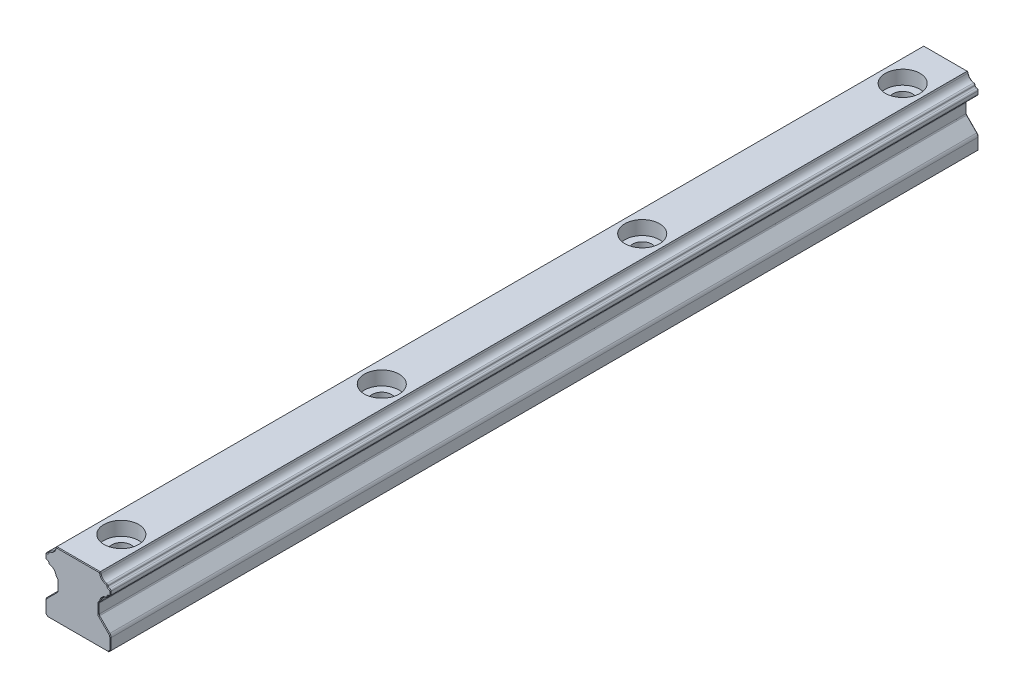
from build123d import *

# Parameters (mm, degrees)
BODY_DEPTH                                          = 200
AESTHETIC_CHAMFER_SIZE                              = 0.15
CBORE_FOR_M4_HEX_SOCKET_HEAD_CAP_SCREW1_D           = 4.5
CBORE_FOR_M4_HEX_SOCKET_HEAD_CAP_SCREW1_CBORE_D     = 8
CBORE_FOR_M4_HEX_SOCKET_HEAD_CAP_SCREW1_CBORE_DEPTH = 3.2
LPATTERN1_COUNT                                     = 4
LPATTERN1_PITCH                                     = 60


with BuildPart() as part:
    # Rail Profile → Body (new body)
    with BuildSketch(Plane.XY):
        with BuildLine():
            Line((-7, 0), (7, 0))
            Line((7, 0), (7.5, 0.5))
            Line((7.5, 0.5), (7.5, 3.085786438))
            ThreePointArc((7.5, 3.085786438), (7.423879533, 3.46846987), (7.207106781, 3.792893219))
            Line((7.207106781, 3.792893219), (4.867157288, 6.132842712))
            ThreePointArc((4.867157288, 6.132842712), (4.780448187, 6.262612052), (4.75, 6.415685425))
            Line((4.75, 6.415685425), (4.75, 8.584314575))
            ThreePointArc((4.75, 8.584314575), (4.780448187, 8.737387948), (4.867157288, 8.867157288))
            Line((4.867157288, 8.867157288), (5.062965362, 9.062965362))
            ThreePointArc((5.062965362, 9.062965362), (5.134996734, 9.161242682), (5.17409812, 9.27664646))
            ThreePointArc((5.17409812, 9.27664646), (5.61862915, 10.13137085), (6.47335354, 10.57590188))
            ThreePointArc((6.47335354, 10.57590188), (6.694124352, 10.694306692), (6.801170165, 10.920803148))
            ThreePointArc((6.801170165, 10.920803148), (6.915305692, 11.154571658), (7.149074202, 11.268707185))
            ThreePointArc((7.149074202, 11.268707185), (7.399691242, 11.400760606), (7.5, 11.665685425))
            Line((7.5, 11.665685425), (7.5, 12.334314575))
            ThreePointArc((7.5, 12.334314575), (7.399691242, 12.599239394), (7.149074202, 12.731292815))
            ThreePointArc((7.149074202, 12.731292815), (6.915305692, 12.845428342), (6.801170165, 13.079196852))
            ThreePointArc((6.801170165, 13.079196852), (6.694124352, 13.305693308), (6.47335354, 13.42409812))
            ThreePointArc((6.47335354, 13.42409812), (5.61862915, 13.86862915), (5.17409812, 14.72335354))
            ThreePointArc((5.17409812, 14.72335354), (5.134996734, 14.838757318), (5.062965362, 14.937034638))
            Line((5.062965362, 14.937034638), (5, 15))
            Line((5, 15), (-5, 15))
            Line((-5, 15), (-5.062965362, 14.937034638))
            ThreePointArc((-5.062965362, 14.937034638), (-5.134996734, 14.838757318), (-5.17409812, 14.72335354))
            ThreePointArc((-5.17409812, 14.72335354), (-5.61862915, 13.86862915), (-6.47335354, 13.42409812))
            ThreePointArc((-6.47335354, 13.42409812), (-6.694124352, 13.305693308), (-6.801170165, 13.079196852))
            ThreePointArc((-6.801170165, 13.079196852), (-6.915305692, 12.845428342), (-7.149074202, 12.731292815))
            ThreePointArc((-7.149074202, 12.731292815), (-7.399691242, 12.599239394), (-7.5, 12.334314575))
            Line((-7.5, 12.334314575), (-7.5, 11.665685425))
            ThreePointArc((-7.5, 11.665685425), (-7.399691242, 11.400760606), (-7.149074202, 11.268707185))
            ThreePointArc((-7.149074202, 11.268707185), (-6.915305692, 11.154571658), (-6.801170165, 10.920803148))
            ThreePointArc((-6.801170165, 10.920803148), (-6.694124352, 10.694306692), (-6.47335354, 10.57590188))
            ThreePointArc((-6.47335354, 10.57590188), (-5.61862915, 10.13137085), (-5.17409812, 9.27664646))
            ThreePointArc((-5.17409812, 9.27664646), (-5.134996734, 9.161242682), (-5.062965362, 9.062965362))
            Line((-5.062965362, 9.062965362), (-4.867157288, 8.867157288))
            ThreePointArc((-4.867157288, 8.867157288), (-4.780448187, 8.737387948), (-4.75, 8.584314575))
            Line((-4.75, 8.584314575), (-4.75, 6.415685425))
            ThreePointArc((-4.75, 6.415685425), (-4.780448187, 6.262612052), (-4.867157288, 6.132842712))
            Line((-4.867157288, 6.132842712), (-7.207106781, 3.792893219))
            ThreePointArc((-7.207106781, 3.792893219), (-7.423879533, 3.46846987), (-7.5, 3.085786438))
            Line((-7.5, 3.085786438), (-7.5, 0.5))
            Line((-7.5, 0.5), (-7, 0))
        make_face()
    extrude(amount=-BODY_DEPTH)

    # Aesthetic Chamfer
    aesthetic_chamfer_edges = [part.edges().sort_by_distance(p)[0] for p in [
        (-5.031482681, 14.968517319, 0),
        (-5.134996734, 14.838757318, 0),
        (-5.61862915, 13.86862915, 0),
        (-6.694124352, 13.305693308, 0),
        (-6.915305692, 12.845428342, 0),
        (-7.399691242, 12.599239394, 0),
        (-7.5, 12, 0),
        (-7.399691242, 11.400760606, 0),
        (-6.915305692, 11.154571658, 0),
        (-6.694124352, 10.694306692, 0),
        (-5.61862915, 10.13137085, 0),
        (-5.134996734, 9.161242682, 0),
        (-4.965061325, 8.965061325, 0),
        (-4.780448187, 8.737387948, 0),
        (-4.75, 7.5, 0),
        (-4.780448187, 6.262612052, 0),
        (-6.037132034, 4.962867966, 0),
        (-7.423879533, 3.46846987, 0),
        (-7.5, 1.792893219, 0),
        (-7.25, 0.25, 0),
        (0, 0, 0),
        (7.25, 0.25, 0),
        (5.031482681, 14.968517319, 0),
        (5.134996734, 14.838757318, 0),
        (5.61862915, 13.86862915, 0),
        (6.694124352, 13.305693308, 0),
        (6.915305692, 12.845428342, 0),
        (7.399691242, 12.599239394, 0),
        (7.5, 12, 0),
        (7.399691242, 11.400760606, 0),
        (6.915305692, 11.154571658, 0),
        (6.694124352, 10.694306692, 0),
        (5.61862915, 10.13137085, 0),
        (5.134996734, 9.161242682, 0),
        (4.965061325, 8.965061325, 0),
        (4.780448187, 8.737387948, 0),
        (7.5, 1.792893219, 0),
        (4.75, 7.5, 0),
        (7.423879533, 3.46846987, 0),
        (4.780448187, 6.262612052, 0),
        (6.037132034, 4.962867966, 0),
        (0, 15, 0),
        (5.031482681, 14.968517319, -200),
        (5.134996734, 14.838757318, -200),
        (5.61862915, 13.86862915, -200),
        (6.694124352, 13.305693308, -200),
        (6.915305692, 12.845428342, -200),
        (7.399691242, 12.599239394, -200),
        (7.5, 12, -200),
        (7.399691242, 11.400760606, -200),
        (6.915305692, 11.154571658, -200),
        (6.694124352, 10.694306692, -200),
        (5.61862915, 10.13137085, -200),
        (5.134996734, 9.161242682, -200),
        (4.965061325, 8.965061325, -200),
        (4.780448187, 8.737387948, -200),
        (4.75, 7.5, -200),
        (4.780448187, 6.262612052, -200),
        (6.037132034, 4.962867966, -200),
        (7.423879533, 3.46846987, -200),
        (7.5, 1.792893219, -200),
        (7.25, 0.25, -200),
        (0, 0, -200),
        (-7.25, 0.25, -200),
        (-5.031482681, 14.968517319, -200),
        (-5.134996734, 14.838757318, -200),
        (-5.61862915, 13.86862915, -200),
        (-6.694124352, 13.305693308, -200),
        (-6.915305692, 12.845428342, -200),
        (-7.399691242, 12.599239394, -200),
        (-7.5, 12, -200),
        (-7.399691242, 11.400760606, -200),
        (-6.915305692, 11.154571658, -200),
        (-6.694124352, 10.694306692, -200),
        (-5.61862915, 10.13137085, -200),
        (-7.5, 1.792893219, -200),
        (-5.134996734, 9.161242682, -200),
        (-7.423879533, 3.46846987, -200),
        (-4.965061325, 8.965061325, -200),
        (-6.037132034, 4.962867966, -200),
        (-4.780448187, 8.737387948, -200),
        (-4.780448187, 6.262612052, -200),
        (-4.75, 7.5, -200),
        (0, 15, -200),
    ]]
    chamfer(aesthetic_chamfer_edges, length=AESTHETIC_CHAMFER_SIZE)

    # CBORE for M4 Hex Socket Head Cap Screw1 (through all)
    with Locations(Plane(origin=(0, 15, 0), x_dir=(1, 0, 0), z_dir=(0, 1, 0))):
        with Locations((0, 10)):
            cbore_for_m4_hex_socket_head_cap_screw1 = CounterBoreHole(CBORE_FOR_M4_HEX_SOCKET_HEAD_CAP_SCREW1_D / 2, CBORE_FOR_M4_HEX_SOCKET_HEAD_CAP_SCREW1_CBORE_D / 2, CBORE_FOR_M4_HEX_SOCKET_HEAD_CAP_SCREW1_CBORE_DEPTH)

    # LPattern1: CBORE for M4 Hex Socket Head Cap Screw1 ×4
    with Locations(*[(0, 0, -i * LPATTERN1_PITCH) for i in range(1, LPATTERN1_COUNT)]):
        add(cbore_for_m4_hex_socket_head_cap_screw1, mode=Mode.SUBTRACT)


solid = part.part
